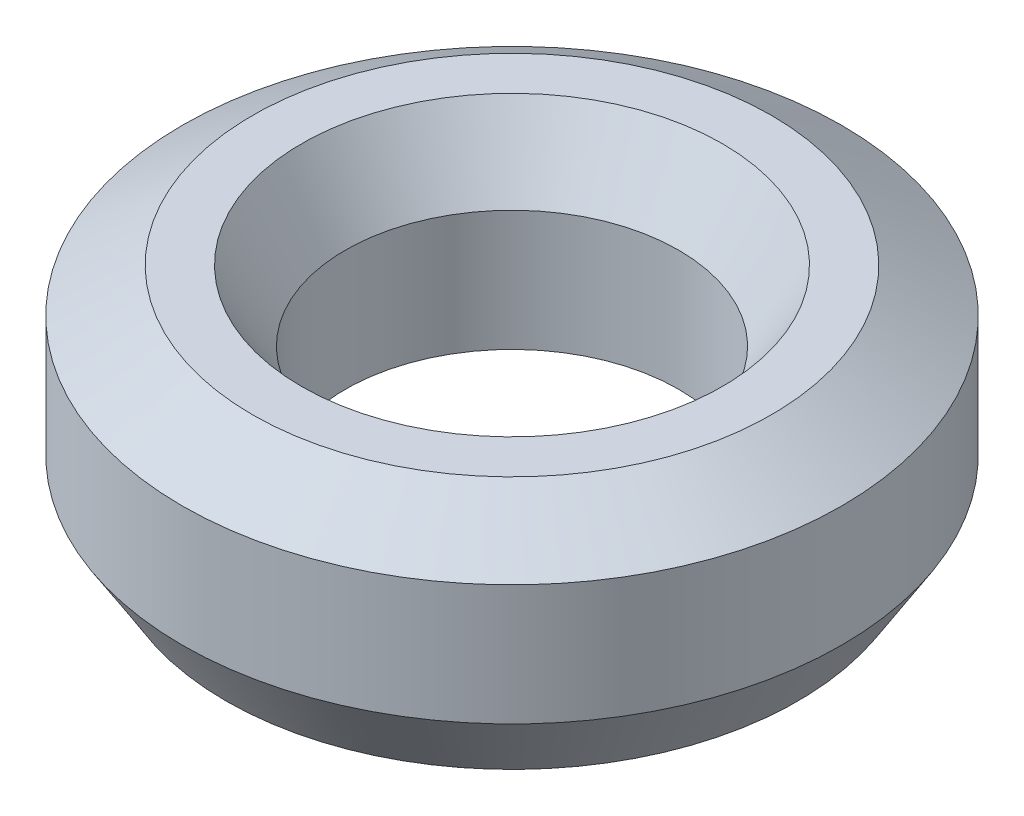
from build123d import *
from OCP.BRepFilletAPI import BRepFilletAPI_MakeChamfer

# Parameters (mm, degrees)
SKETCH1_R           = 27.5
BOSS_EXTRUDE1_DEPTH = 19.56875599
SKETCH2_R           = 13.897650692
CUT_EXTRUDE1_DEPTH  = 44.536607711
CHAMFER1_SIZE       = 3.649955625
CHAMFER1_SIZE2      = 5.864892688


with BuildPart() as part:
    # Sketch1 → Boss-Extrude1 (new body)
    with BuildSketch(Plane(origin=(0, 0, 0), x_dir=(1, 0, 0), z_dir=(0, 1, 0))):
        Circle(SKETCH1_R)
    extrude(amount=BOSS_EXTRUDE1_DEPTH)

    # Sketch2 → Cut-Extrude1 (cut, through all)
    with BuildSketch(Plane(origin=(0, 0, 0), x_dir=(1, 0, 0), z_dir=(0, 1, 0))):
        Circle(SKETCH2_R)
    extrude(amount=CUT_EXTRUDE1_DEPTH, mode=Mode.SUBTRACT)

    # Chamfer1: one chamfer whose edges measure the first distance from different faces: ONE call of the kernel's chamfer builder (chamfer() names one face for all edges)
    chamfer1_edges_1 = [part.edges().sort_by_distance(p)[0] for p in [
        (-13.897650692, 19.56875599, 0),
    ]]
    chamfer1_side_1 = [part.faces().sort_by_distance(p)[0] for p in [
        (-26.722182541, 19.56875599, 0),
    ]]
    chamfer1_edges_2 = [part.edges().sort_by_distance(p)[0] for p in [
        (-13.897650692, 0, 0),
    ]]
    chamfer1_side_2 = [part.faces().sort_by_distance(p)[0] for p in [
        (-13.897650692, 9.784377995, 0),
    ]]
    chamfer1_edges_3 = [part.edges().sort_by_distance(p)[0] for p in [
        (-27.5, 0, 0),
    ]]
    chamfer1_side_3 = [part.faces().sort_by_distance(p)[0] for p in [
        (-26.722182541, 0, 0),
    ]]
    chamfer1_edges_4 = [part.edges().sort_by_distance(p)[0] for p in [
        (-27.5, 19.56875599, 0),
    ]]
    chamfer1_side_4 = [part.faces().sort_by_distance(p)[0] for p in [
        (-27.5, 9.784377995, 0),
    ]]
    chamfer1 = BRepFilletAPI_MakeChamfer(part.part.solid().wrapped)
    for e in chamfer1_edges_1:
        chamfer1.Add(CHAMFER1_SIZE, CHAMFER1_SIZE2, e.wrapped, chamfer1_side_1[0].wrapped)  # the first distance lies on this face
    for e in chamfer1_edges_2:
        chamfer1.Add(CHAMFER1_SIZE, CHAMFER1_SIZE2, e.wrapped, chamfer1_side_2[0].wrapped)  # the first distance lies on this face
    for e in chamfer1_edges_3:
        chamfer1.Add(CHAMFER1_SIZE, CHAMFER1_SIZE2, e.wrapped, chamfer1_side_3[0].wrapped)  # the first distance lies on this face
    for e in chamfer1_edges_4:
        chamfer1.Add(CHAMFER1_SIZE, CHAMFER1_SIZE2, e.wrapped, chamfer1_side_4[0].wrapped)  # the first distance lies on this face
    add(Compound.cast(chamfer1.Shape()), mode=Mode.REPLACE)


solid = part.part
